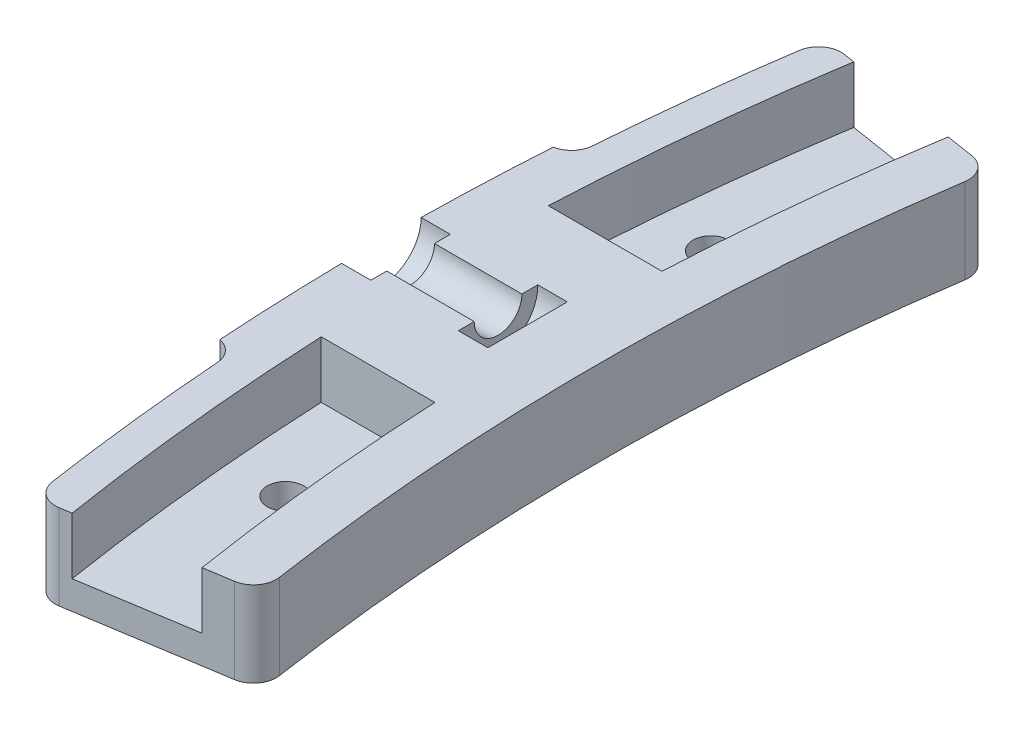
from build123d import *

# Parameters (mm, degrees)
BOSS_EXTRUDE1_DEPTH            = 7.5
BOSS_EXTRUDE2_DEPTH            = 7.5
CUT_EXTRUDE1_DEPTH             = 5
F_3_2_3_2_DIAMETER_HOLE1_D     = 3.2
FILLET1_R                      = 2
FILLET2_R                      = 2
CUT_EXTRUDE2_REACH             = 39.378
CUT_EXTRUDE2_END_RADIUS        = 224.5
SKETCH22_R                     = 2.1
CUT_EXTRUDE2_DIRECTION_2_DEPTH = 0.9
SKETCH23_R                     = 3.5
CUT_EXTRUDE3_DEPTH             = 2.6
SKETCH24_W                     = 2.6
SKETCH24_H                     = 3.5


with BuildPart() as part:
    # Sketch1 → Boss-Extrude1 (new body)
    with BuildSketch(Plane(origin=(0, 0, 0), x_dir=(1, 0, 0), z_dir=(0, 1, 0))):
        with BuildLine():
            ThreePointArc((-207.414551525, 32.851237658), (-210, 0), (-207.414551525, -32.851237658))
            Line((-207.414551525, -32.851237658), (-217.291434931, -34.415582309))
            ThreePointArc((-217.291434931, -34.415582309), (-220, 0), (-217.291434931, 34.415582309))
            Line((-217.291434931, 34.415582309), (-207.414551525, 32.851237658))
        make_face()
        with BuildLine():
            ThreePointArc((-217.291434931, -34.415582309), (-220, 0), (-217.291434931, 34.415582309))
            Line((-217.291434931, 34.415582309), (-220.254499953, 34.884885704))
            ThreePointArc((-220.254499953, 34.884885704), (-223, 0), (-220.254499953, -34.884885704))
            Line((-220.254499953, -34.884885704), (-217.291434931, -34.415582309))
        make_face()
        with BuildLine():
            Line((-202.969953992, 32.147282566), (-207.414551525, 32.851237658))
            ThreePointArc((-207.414551525, 32.851237658), (-210, 0), (-207.414551525, -32.851237658))
            Line((-207.414551525, -32.851237658), (-202.969953992, -32.147282566))
            ThreePointArc((-202.969953992, -32.147282566), (-205.5, 0), (-202.969953992, 32.147282566))
        make_face()
    extrude(amount=BOSS_EXTRUDE1_DEPTH)

    # Sketch19 → Boss-Extrude2 (add)
    with BuildSketch(Plane(origin=(0, 0, 0), x_dir=(1, 0, 0), z_dir=(0, 1, 0))):
        with BuildLine():
            Line((-224.019328267, 14.683002512), (-222.522539882, 14.584897818))
            ThreePointArc((-222.522539882, 14.584897818), (-223, 0), (-222.522539882, -14.584897818))
            Line((-222.522539882, -14.584897818), (-224.019328267, -14.683002512))
            ThreePointArc((-224.019328267, -14.683002512), (-224.5, 0), (-224.019328267, 14.683002512))
        make_face()
    extrude(amount=BOSS_EXTRUDE2_DEPTH)

    # Sketch15 → Cut-Extrude1 (cut)
    with BuildSketch(Plane(origin=(0, 7.5, 0), x_dir=(1, 0, 0), z_dir=(0, 1, 0))):
        with BuildLine():
            Line((-219.772609758, 10), (-209.761769634, 10))
            ThreePointArc((-209.761769634, 10), (-208.900850883, 21.457737542), (-207.414551525, 32.851237658))
            Line((-207.414551525, 32.851237658), (-217.291434931, 34.415582309))
            ThreePointArc((-217.291434931, 34.415582309), (-218.872736893, 22.242415451), (-219.772609758, 10))
        make_face()
        with BuildLine():
            ThreePointArc((-207.414551525, -32.851237658), (-208.900850883, -21.457737542), (-209.761769634, -10))
            Line((-209.761769634, -10), (-219.772609758, -10))
            ThreePointArc((-219.772609758, -10), (-218.872736893, -22.242415451), (-217.291434931, -34.415582309))
            Line((-217.291434931, -34.415582309), (-207.414551525, -32.851237658))
        make_face()
    extrude(amount=-CUT_EXTRUDE1_DEPTH, mode=Mode.SUBTRACT)

    # Ø3.2 (3.2) Diameter Hole1 (through all)
    with Locations(Plane(origin=(0, 0, 0), x_dir=(-1, 0, 0), z_dir=(0, -1, 0))):
        with Locations((214.18186009, -18.738484691), (214.18186009, 18.738484691)):
            Hole(F_3_2_3_2_DIAMETER_HOLE1_D / 2)

    # Fillet1
    fillet1_edges = [part.edges().sort_by_distance(p)[0] for p in [
        (-220.254499953, 3.75, 34.884885704),
        (-220.254499953, 3.75, -34.884885704),
        (-202.969953992, 3.75, -32.147282566),
        (-202.969953992, 3.75, 32.147282566),
    ]]
    fillet(fillet1_edges, radius=FILLET1_R)

    # Fillet2
    # the kernel refuses this fillet: 2 mm, written as the material it adds along each edge
    with BuildSketch(Plane(origin=(-222.522539882, 0, -14.584897818), x_dir=(0.06970140258603677, 0, -0.9975678996827931), z_dir=(0, 1, 0))) as fillet2_piece_1:
        with BuildLine():
            CenterArc((1.930030715, 1.99998144), FILLET2_R, 194.477374901, 75.275788142)
            Line((-0.006462156, 1.49998608), (-0.045192014, 1.489986173))
            ThreePointArc((-0.045192014, 1.489986173), (-0.043230707, 0.749820716), (-0.039999629, -0.000172324))
            Line((-0.039999629, -0.000172324), (0.000172324, -0.039999629))
            ThreePointArc((0.000172324, -0.039999629), (0.960707253, -0.037930577), (1.921242182, -0.039999629))
            Line((1.921242182, -0.039999629), (1.921414506, 0))
        make_face()
    extrude(amount=7.5)
    with BuildSketch(Plane(origin=(-222.522539882, 0, 14.584897818), x_dir=(-0.9978589232386029, 0, 0.06540312923015226), z_dir=(0, 1, 0))) as fillet2_piece_2:
        with BuildLine():
            CenterArc((1.991648107, 1.938628933), FILLET2_R, 180.493673912, 75.275788142)
            Line((-0.008277654, 1.921396676), (-0.048276169, 1.92105203))
            ThreePointArc((-0.048276169, 1.92105203), (-0.042069052, 0.960534929), (-0.04, 0))
            Line((-0.04, 0), (0, -0.04))
            ThreePointArc((0, -0.04), (0.75, -0.04), (1.490167038, -0.038772579))
            Line((1.490167038, -0.038772579), (1.5, 0))
        make_face()
    extrude(amount=7.5)

    # Cut-Extrude2: up to this cylinder (the profile starts inside it)
    cut_extrude2_end = Plane(origin=(0, 7.5, 0), z_dir=(0, -1, 0)) * Cylinder(CUT_EXTRUDE2_END_RADIUS, 528.756, mode=Mode.PRIVATE)
    # Sketch22 → Cut-Extrude2 (cut, up to the surface)
    with BuildSketch(Plane(origin=(-212.5, 0, 0), x_dir=(0, 0, -1), z_dir=(1, 0, 0)), mode=Mode.PRIVATE) as cut_extrude2_sk1:
        with Locations((0, 7.5)):
            Circle(SKETCH22_R)
    cut_extrude2_tool1 = extrude(cut_extrude2_sk1.sketch, amount=-CUT_EXTRUDE2_REACH, mode=Mode.PRIVATE) & cut_extrude2_end
    add(cut_extrude2_tool1.solids().sort_by_distance((-212.5, 7.5, 0))[0], mode=Mode.SUBTRACT)

    # Sketch22 → Cut-Extrude2 direction 2 (cut)
    with BuildSketch(Plane(origin=(-212.5, 0, 0), x_dir=(0, 0, -1), z_dir=(1, 0, 0))):
        with Locations((0, 7.5)):
            Circle(SKETCH22_R)
    extrude(amount=CUT_EXTRUDE2_DIRECTION_2_DEPTH, mode=Mode.SUBTRACT)

    # Sketch23 → Cut-Extrude3 (cut)
    with BuildSketch(Plane.ZY.offset(211.6)):
        with Locations((0, 7.439199918)):
            Circle(SKETCH23_R)
    extrude(amount=CUT_EXTRUDE3_DEPTH, mode=Mode.SUBTRACT)

    # Sketch24 → Cut-Revolve1 (revolve, cut)
    with BuildSketch(Plane(origin=(0, 7.5, 0), x_dir=(1, 0, 0), z_dir=(0, 1, 0))):
        with Locations((-223.2, 1.75)):
            Rectangle(SKETCH24_W, SKETCH24_H)
    revolve(axis=Axis((-224.5, 7.5, 0), (1, 0, 0)), mode=Mode.SUBTRACT)


solid = part.part
